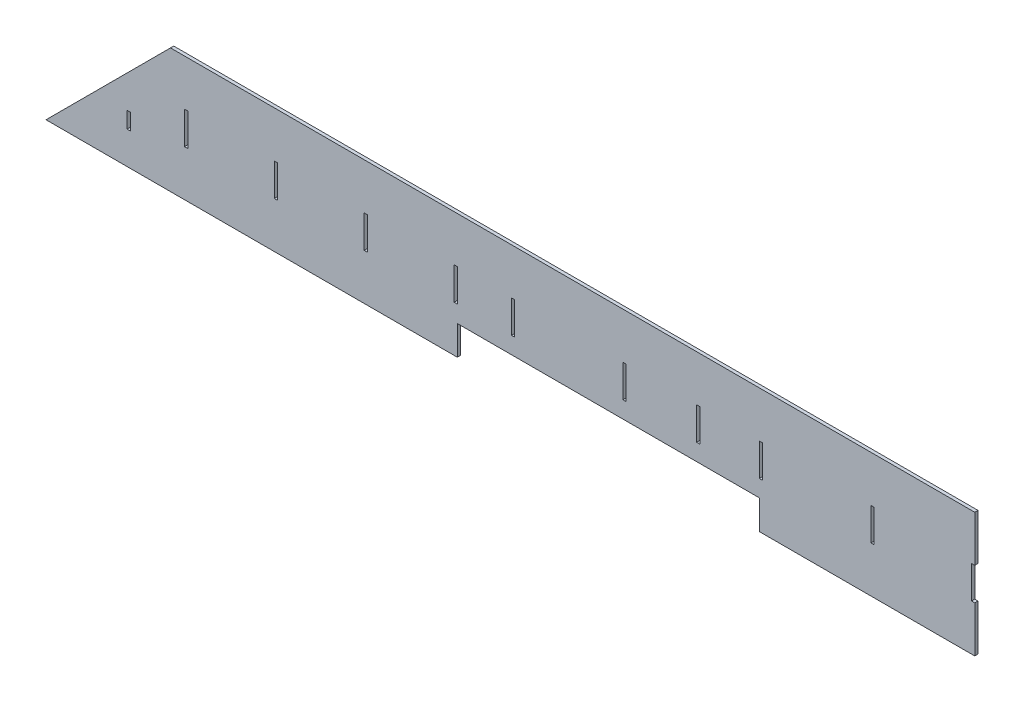
from build123d import *

# Parameters (mm, degrees)
SKETCH1_W           = 3
SKETCH1_H           = 30
SKETCH1_H_2         = 15
BOSS_EXTRUDE1_DEPTH = 3
SKETCH2_W           = 279
SKETCH2_H           = 27
CUT_EXTRUDE1_DEPTH  = 10


with BuildPart() as part:
    # Sketch1 → Boss-Extrude1 (new body)
    with BuildSketch(Plane.XY):
        Polygon((0, 0), (115, 115), (858, 115), (858, 72.5), (855, 72.5), (855, 42.5), (858, 42.5), (858, 0), align=None)
        with Locations((129.5, 57.5)):
            Rectangle(SKETCH1_W, SKETCH1_H, mode=Mode.SUBTRACT)
        with Locations((76.5, 37.5)):
            Rectangle(SKETCH1_W, SKETCH1_H_2, mode=Mode.SUBTRACT)
        with Locations((212.5, 57.5)):
            Rectangle(SKETCH1_W, SKETCH1_H, mode=Mode.SUBTRACT)
        with Locations((295.5, 57.5)):
            Rectangle(SKETCH1_W, SKETCH1_H, mode=Mode.SUBTRACT)
        with Locations((378.5, 57.5)):
            Rectangle(SKETCH1_W, SKETCH1_H, mode=Mode.SUBTRACT)
        with Locations((431.5, 57.5)):
            Rectangle(SKETCH1_W, SKETCH1_H, mode=Mode.SUBTRACT)
        with Locations((534.5, 57.5)):
            Rectangle(SKETCH1_W, SKETCH1_H, mode=Mode.SUBTRACT)
        with Locations((602.5, 57.5)):
            Rectangle(SKETCH1_W, SKETCH1_H, mode=Mode.SUBTRACT)
        with Locations((660.5, 57.5)):
            Rectangle(SKETCH1_W, SKETCH1_H, mode=Mode.SUBTRACT)
        with Locations((763.5, 57.5)):
            Rectangle(SKETCH1_W, SKETCH1_H, mode=Mode.SUBTRACT)
    extrude(amount=BOSS_EXTRUDE1_DEPTH)

    # Sketch2 → Cut-Extrude1 (cut)
    with BuildSketch(Plane.XY.offset(3)):
        with Locations((519.5, 13.5)):
            Rectangle(SKETCH2_W, SKETCH2_H)
    extrude(amount=-CUT_EXTRUDE1_DEPTH, mode=Mode.SUBTRACT)


solid = part.part
